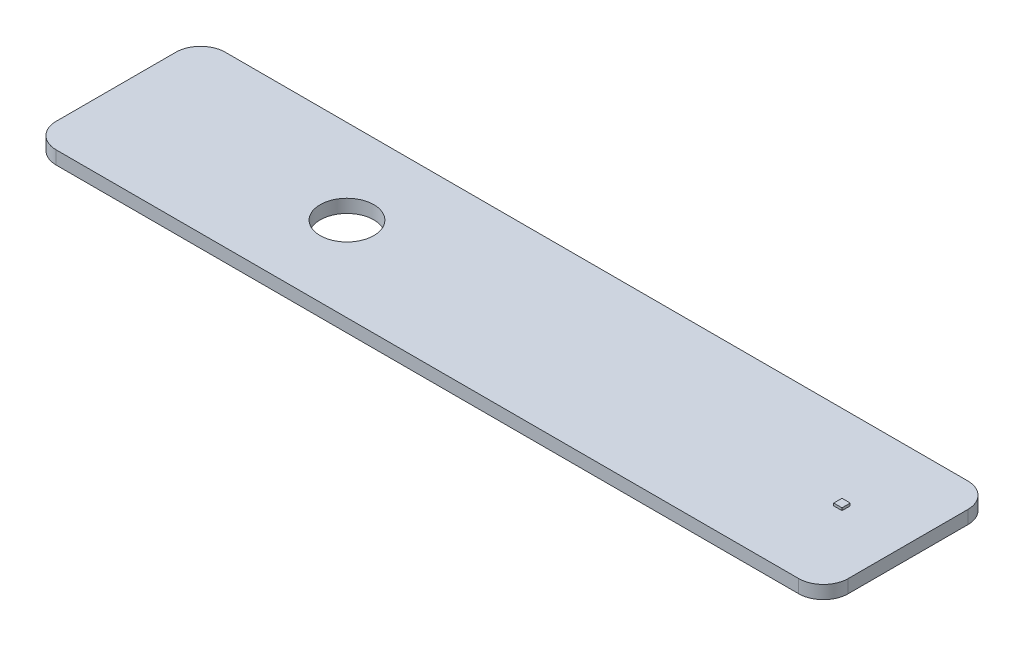
from build123d import *

# Parameters (mm, degrees)
BOSS_EXTRUDE1_DEPTH = 1.6
SKETCH2_W           = 1
SKETCH2_H           = 1
BOSS_EXTRUDE2_DEPTH = 0.3
SKETCH3_R           = 3.25
CUT_EXTRUDE1_DEPTH  = 50.108273234


with BuildPart() as part:
    # Sketch1 → Boss-Extrude1 (new body)
    with BuildSketch(Plane(origin=(0, 0, 0), x_dir=(1, 0, 0), z_dir=(0, 1, 0))):
        with BuildLine():
            Line((-45, 10.25), (45, 10.25))
            ThreePointArc((45, 10.25), (47.121320344, 9.371320344), (48, 7.25))
            Line((48, 7.25), (48, -7.25))
            ThreePointArc((48, -7.25), (47.121320344, -9.371320344), (45, -10.25))
            Line((45, -10.25), (-45, -10.25))
            ThreePointArc((-45, -10.25), (-47.121320344, -9.371320344), (-48, -7.25))
            Line((-48, -7.25), (-48, 7.25))
            ThreePointArc((-48, 7.25), (-47.121320344, 9.371320344), (-45, 10.25))
        make_face()
    extrude(amount=BOSS_EXTRUDE1_DEPTH)

    # Sketch2 → Boss-Extrude2 (add)
    with BuildSketch(Plane(origin=(0, 1.6, 0), x_dir=(1, 0, 0), z_dir=(0, 1, 0))):
        with Locations((40, 0)):
            Rectangle(SKETCH2_W, SKETCH2_H)
    extrude(amount=BOSS_EXTRUDE2_DEPTH)

    # Sketch3 → Cut-Extrude1 (cut, through all)
    with BuildSketch(Plane(origin=(0, 1.6, 0), x_dir=(1, 0, 0), z_dir=(0, 1, 0))):
        with Locations((-20, 0)):
            Circle(SKETCH3_R)
    extrude(amount=-CUT_EXTRUDE1_DEPTH, mode=Mode.SUBTRACT)


solid = part.part
